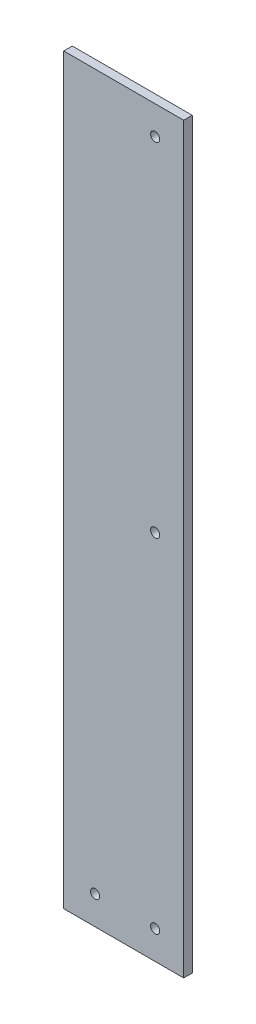
from build123d import *

# Parameters (mm, degrees)
SKETCH1_W                    = 42
SKETCH1_H                    = 260
BOSS_EXTRUDE1_DEPTH          = 3
M3_CLEARANCE_HOLE1_OUTLINE_R = 1.6
M3_CLEARANCE_HOLE1_DEPTH     = 3


# Read off the part's stored shape, not the designer's step: M3 Clearance Hole1
with BuildPart() as part:
    # Sketch1 → Boss-Extrude1 (new body)
    with BuildSketch(Plane.XY):
        with Locations((21, 130)):
            Rectangle(SKETCH1_W, SKETCH1_H)
    extrude(amount=BOSS_EXTRUDE1_DEPTH)

    # M3 Clearance Hole1 outline → M3 Clearance Hole1 (cut)
    with BuildSketch(Plane.XY):
        with Locations((32, 130)):
            Circle(M3_CLEARANCE_HOLE1_OUTLINE_R)
        with Locations((32, 10)):
            Circle(M3_CLEARANCE_HOLE1_OUTLINE_R)
        with Locations((32, 250)):
            Circle(M3_CLEARANCE_HOLE1_OUTLINE_R)
        with Locations((11, 10)):
            Circle(M3_CLEARANCE_HOLE1_OUTLINE_R)
    extrude(amount=M3_CLEARANCE_HOLE1_DEPTH, mode=Mode.SUBTRACT)


solid = part.part
